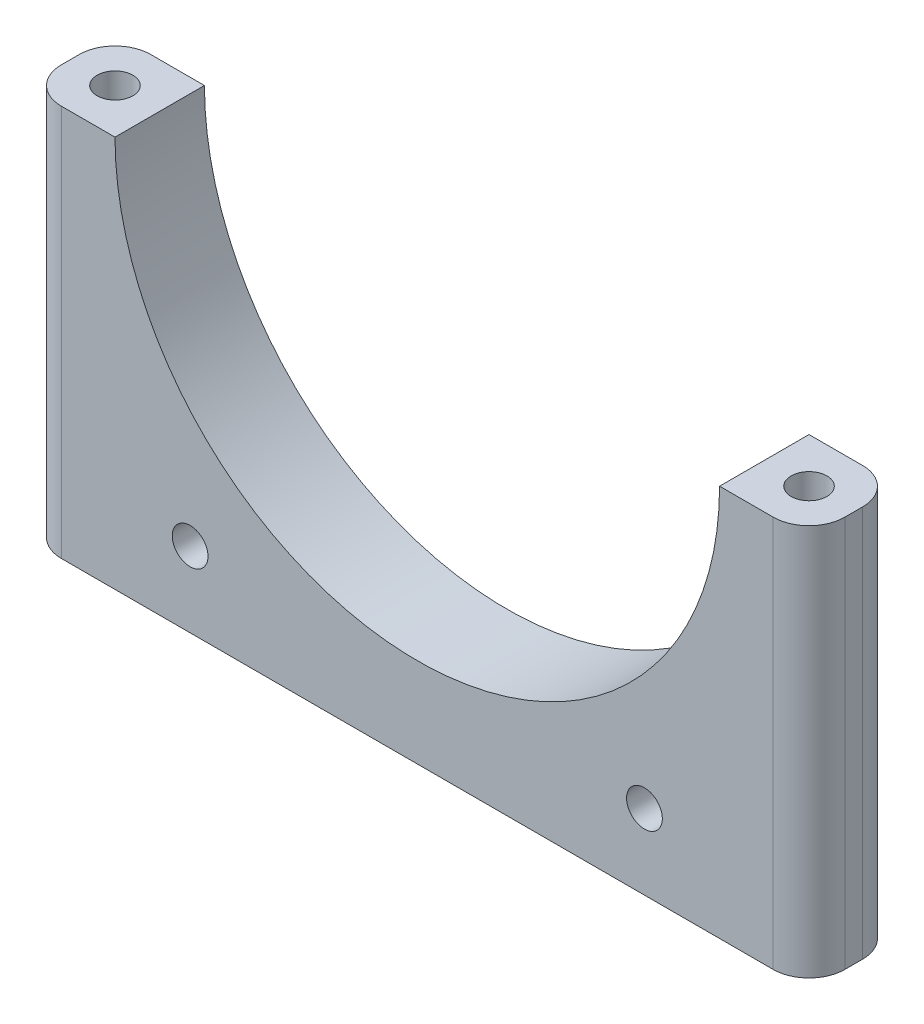
from build123d import *

# Parameters (mm, degrees)
BOSS_EXTRUDE1_DEPTH = 25
SKETCH5_R           = 5
CUT_EXTRUDE1_DEPTH  = 5000
SKETCH6_R           = 5
CUT_EXTRUDE2_DEPTH  = 5000
FILLET2_R           = 10


with BuildPart() as part:
    # Sketch4 → Boss-Extrude1 (new body)
    with BuildSketch(Plane.XY):
        with BuildLine():
            ThreePointArc((84.5, 84.5), (0, 0), (-84.5, 84.5))
            Line((-84.5, 84.5), (-109.5, 84.5))
            Line((-109.5, 84.5), (-109.5, -25))
            Line((-109.5, -25), (109.5, -25))
            Line((109.5, -25), (109.5, 84.5))
            Line((109.5, 84.5), (84.5, 84.5))
        make_face()
    extrude(amount=BOSS_EXTRUDE1_DEPTH)

    # Sketch5 → Cut-Extrude1 (cut)
    with BuildSketch(Plane(origin=(0, 84.5, 0), x_dir=(1, 0, 0), z_dir=(0, 1, 0))):
        with Locations((-97, -12.5)):
            Circle(SKETCH5_R)
        with Locations((97, -12.5)):
            Circle(SKETCH5_R)
    extrude(amount=-CUT_EXTRUDE1_DEPTH, mode=Mode.SUBTRACT)

    # Sketch6 → Cut-Extrude2 (cut)
    with BuildSketch(Plane.XY.offset(25)):
        with Locations((-63.5, -4)):
            Circle(SKETCH6_R)
        with Locations((63.5, -4)):
            Circle(SKETCH6_R)
    extrude(amount=-CUT_EXTRUDE2_DEPTH, mode=Mode.SUBTRACT)

    # Fillet2
    fillet2_edges = [part.edges().sort_by_distance(p)[0] for p in [
        (109.5, 29.75, 25),
        (109.5, 29.75, 0),
        (-109.5, 29.75, 25),
        (-109.5, 29.75, 0),
    ]]
    fillet(fillet2_edges, radius=FILLET2_R)


solid = part.part
